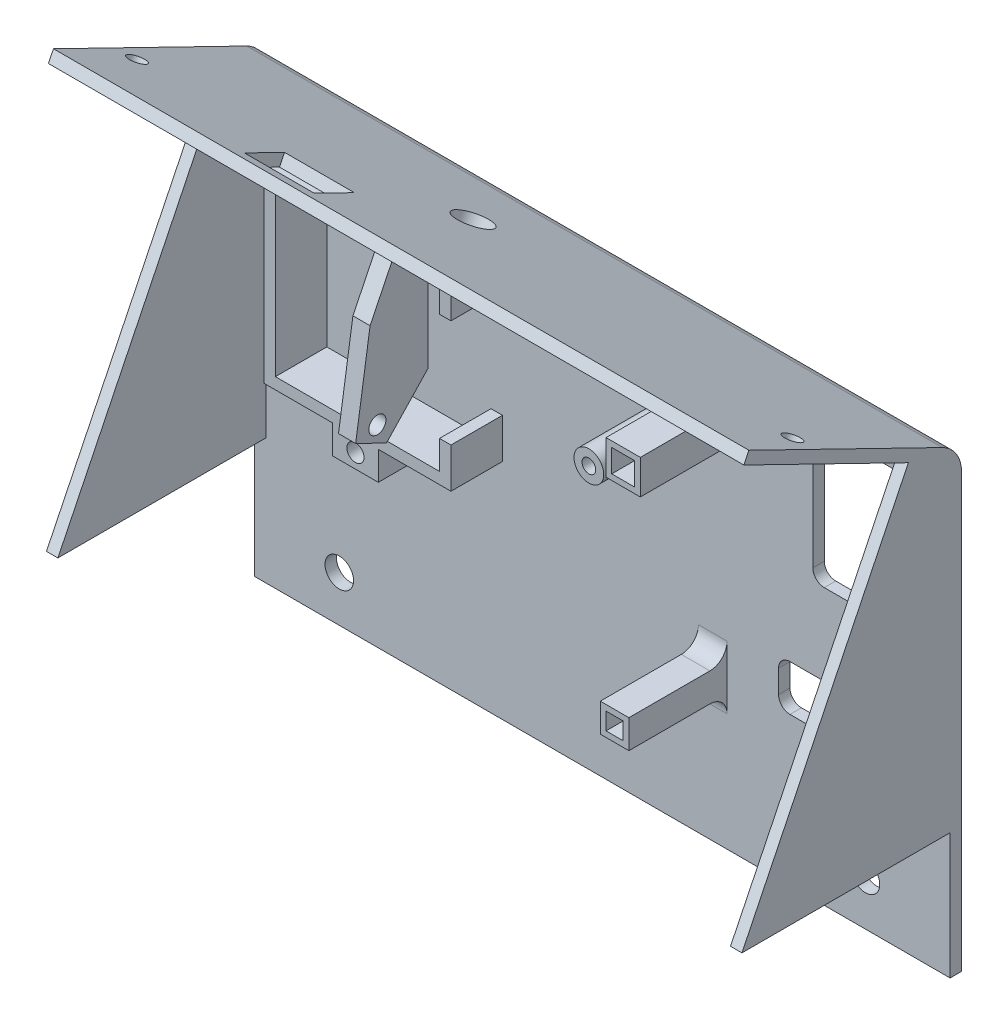
from build123d import *

# Parameters (mm, degrees)
CROQUIS1_W                 = 2
CROQUIS1_H                 = 22
SALIENTE_EXTRUIR1_DEPTH    = 121.6
VACIADO1_START             = -119.6
VACIADO1_DEPTH             = 117.6
CORTAR_EXTRUIR2_DEPTH      = 2
CROQUIS7_W                 = 10
CROQUIS7_H                 = 8
CORTAR_EXTRUIR3_DEPTH      = 10
SALIENTE_EXTRUIR4_START    = -72
CROQUIS8_W                 = 5.999999999999993
CROQUIS8_H                 = 6
CROQUIS8_W_2               = 5.000000000000007
CROQUIS8_H_2               = 5
CROQUIS8_R                 = 2.599999999999998
CROQUIS8_R_2               = 1.2000000000000022
SALIENTE_EXTRUIR4_DEPTH    = 18
REDONDEO1_R                = 3
CROQUIS10_W                = 3
CROQUIS10_H                = 16.000000000000004
SALIENTE_EXTRUIR5_DEPTH    = 30
CROQUIS10_4_R              = 3.000000000000008
CORTAR_EXTRUIR6_DEPTH      = 155.97562792830414
CROQUIS18_R                = 1.5000000000000042
CORTAR_EXTRUIR12_DEPTH     = 10
REDONDEO5_R                = 2
CORTAR_EXTRUIR13_REACH     = 172.896
CROQUIS13_R                = 1.4999999999999973
SALIENTE_EXTRUIR6_DEPTH    = 9
CORTAR_EXTRUIR18_REACH     = 146.158
REDONDEO6_R                = 2
CROQUIS14_R                = 2.499999999999995
CROQUIS14_R_2              = 2.4999999999999902
CORTAR_EXTRUIR9_DEPTH      = 10
REDONDEO4_R                = 2
CROQUIS16_R                = 1.4999999999999971
CROQUIS16_R_2              = 1.4999999999999967
CORTAR_EXTRUIR11_DEPTH     = 10
CORTAR_EXTRUIR19_REACH     = 157.881
REDONDEO7_R                = 6
CORTAR_EXTRUIR20_START     = -5
CORTAR_EXTRUIR20_OUTLINE_W = 5
CORTAR_EXTRUIR20_OUTLINE_H = 0.8399999999999963
CORTAR_EXTRUIR20_DEPTH     = 5
CORTAR_EXTRUIR21_START     = -6
CORTAR_EXTRUIR21_OUTLINE_W = 6
CORTAR_EXTRUIR21_OUTLINE_H = 0.8399999999999963
CORTAR_EXTRUIR21_DEPTH     = 6
CORTAR_EXTRUIR22_START     = -0.8400000000000002
CROQUIS25_R                = 2.599999999999998
CROQUIS25_R_2              = 1.1999999999999982
CORTAR_EXTRUIR22_DEPTH     = 0.8400000000000002


# Read off the part's stored shape, not the designer's step: Vaciado1, Cortar-Extruir20, Cortar-Extruir21
with BuildPart() as part:
    # Croquis1 → Saliente-Extruir1 (new body)
    with BuildSketch(Plane(origin=(0, 0, 0), x_dir=(0, 0, -1), z_dir=(1, 0, 0))):
        with Locations((73, 11)):
            Rectangle(CROQUIS1_W, CROQUIS1_H)
        Polygon((72, 78.1166127422233), (72, 22), (74, 22), (74, 77.14114756509154), align=None)
        Polygon((64.70784351827794, 81.67323509928094), (72, 78.11661274222328), (74, 77.14114756509154), (74, 79.36635144604195), (65.5845858118561, 83.47082319187929), align=None)
        Polygon((36.82317633028281, 97.49869988912988), (35.94643403670465, 95.70111179653155), (64.70784351827794, 81.67323509928094), (65.5845858118561, 83.47082319187929), align=None)
        Polygon((35.603262095206105, 22), (72, 22), (72, 78.1166127422233), (64.70784351827794, 81.67323509928094), align=None)
    extrude(amount=-SALIENTE_EXTRUIR1_DEPTH)

    # Vaciado1 outline → Vaciado1 (cut)
    with BuildSketch(Plane.YZ.offset(VACIADO1_START)):
        Polygon((22, -37.828465976), (22, -72), (78.116612742, -72), (80.796492806, -66.505431611), align=None)
    extrude(amount=VACIADO1_DEPTH, mode=Mode.SUBTRACT)

    # Croquis6 → Cortar-Extruir2 (cut)
    with BuildSketch(Plane(origin=(0, -9.800152925832764, -20.093291191899283), x_dir=(1, 0, 0), z_dir=(0, 0.4383711467890813, 0.8987940462991653))):
        Polygon((-119.6, 35.38091185268935), (-119.6, 99.77346901858166), (-2.0000000000000018, 99.77346901858166), (-1.999999999999988, 35.38091185268935), align=None)
    extrude(amount=-CORTAR_EXTRUIR2_DEPTH, mode=Mode.SUBTRACT)

    # Croquis7 → Cortar-Extruir3 (cut)
    with BuildSketch(Plane.XY.offset(-72)):
        Polygon((-23.999999999999996, 48.116297599242344), (-1.9999999999999971, 48.11629759924235), (-2, 72.11629759924234), (-24, 72.11629759924234), align=None)
        with Locations((-25.000000000000004, 29.91629759924235)):
            Rectangle(CROQUIS7_W, CROQUIS7_H)
        Polygon((-39.99999999999999, 27.499999999999993), (-40, 24.499999999999993), (-43, 24.499999999999993), (-43, 27.499999999999993), align=None)
        Polygon((-38.00000000000001, 67.91629759924236), (-38.00000000000001, 63.91629759924236), (-41.99999999999999, 63.91629759924236), (-42, 67.91629759924237), align=None)
    extrude(amount=-CORTAR_EXTRUIR3_DEPTH, mode=Mode.SUBTRACT)

    # Croquis8 → Saliente-Extruir4 (add)
    # profile 1 of 3: a face of its own
    with BuildSketch(Plane.XY.offset(SALIENTE_EXTRUIR4_START)):
        with Locations((-40, 65.91629759924237)):
            Rectangle(CROQUIS8_W, CROQUIS8_H)
        Polygon((-41.99999999999999, 63.91629759924236), (-42, 67.91629759924237), (-38.00000000000001, 67.91629759924236), (-38.00000000000001, 63.91629759924236), align=None, mode=Mode.SUBTRACT)
    # profile 2 of 3: a face of its own
    with BuildSketch(Plane.XY.offset(SALIENTE_EXTRUIR4_START)):
        with Locations((-41.5, 26.000000000000007)):
            Rectangle(CROQUIS8_W_2, CROQUIS8_H_2)
        Polygon((-43, 24.499999999999993), (-43, 27.499999999999993), (-39.99999999999999, 27.499999999999993), (-40, 24.499999999999993), align=None, mode=Mode.SUBTRACT)
    # profile 3 of 3: a face of its own
    with BuildSketch(Plane.XY.offset(SALIENTE_EXTRUIR4_START)):
        with Locations(Location((-46, 63.116297599242365, 0), (0, 0, 180))):
            Circle(CROQUIS8_R)
        with Locations(Location((-46, 63.116297599242365, 0), (0, 0, 180))):
            Circle(CROQUIS8_R_2, mode=Mode.SUBTRACT)
    extrude(amount=SALIENTE_EXTRUIR4_DEPTH)

    # Redondeo1
    # the kernel refuses this fillet: 3 mm, written as the material it adds along each edge
    with BuildSketch(Plane(origin=(-46, 63.116297599242365, -72), x_dir=(-1, 0, 0), z_dir=(0, 1, 0))) as redondeo1_piece_1_section:
        with BuildLine():
            CenterArc((2.5999999999999943 + REDONDEO1_R, REDONDEO1_R), REDONDEO1_R, 180, 90)
            Line((2.5999999999999943, REDONDEO1_R), (2.5999999999999943, 0))
            Line((2.5999999999999943, 0), (2.5999999999999943 + REDONDEO1_R, 0))
        make_face()
    redondeo1_piece_1 = revolve(axis=Axis((-46, 63.116297599242365, -72), (0, 0, 1)), mode=Mode.PRIVATE)
    redondeo1_piece_1 = split(redondeo1_piece_1, bisect_by=Plane(origin=(-49.240846194400426, 63.91629759924236, -71.32895989591317), z_dir=(0, -1, 0)), keep=Keep.TOP, mode=Mode.PRIVATE)
    add(redondeo1_piece_1)
    with BuildSketch(Plane(origin=(-46, 63.116297599242365, -72), x_dir=(-1, 0, 0), z_dir=(0, 1, 0))) as redondeo1_piece_2_section:
        with BuildLine():
            CenterArc((2.5999999999999943 + REDONDEO1_R, REDONDEO1_R), REDONDEO1_R, 180, 90)
            Line((2.5999999999999943, REDONDEO1_R), (2.5999999999999943, 0))
            Line((2.5999999999999943, 0), (2.5999999999999943 + REDONDEO1_R, 0))
        make_face()
    redondeo1_piece_2 = revolve(axis=Axis((-46, 63.116297599242365, -72), (0, 0, 1)), mode=Mode.PRIVATE)
    redondeo1_piece_2 = split(redondeo1_piece_2, bisect_by=Plane(origin=(-43, 66.57147018864953, -71.13888088116816), z_dir=(-1, 0, 0)), keep=Keep.TOP, mode=Mode.PRIVATE)
    add(redondeo1_piece_2)
    with BuildSketch(Plane(origin=(-37.00000000000001, 62.91629759924236, -72), x_dir=(1, 0, 0), z_dir=(0, 1, 0))) as redondeo1_piece_3:
        with BuildLine():
            CenterArc((REDONDEO1_R, -REDONDEO1_R), REDONDEO1_R, 90, 90)
            Line((0, -REDONDEO1_R), (0, 0))
            Line((0, 0), (REDONDEO1_R, 0))
        make_face()
    extrude(amount=6.000000000000007)
    with BuildSketch(Plane(origin=(-39, 28.500000000000007, -72), x_dir=(0, 1, 0), z_dir=(-1, 0, 0)), Plane(origin=(-44.00000000000001, 23.500000000000007, -72), x_dir=(0, -1, 0), z_dir=(1, 0, 0))) as redondeo1_piece_4:
        with BuildLine():
            CenterArc((REDONDEO1_R, -REDONDEO1_R), REDONDEO1_R, 90, 90)
            Line((0, -REDONDEO1_R), (0, 0))
            Line((0, 0), (REDONDEO1_R, 0))
        make_face()
    extrude(amount=5.000000000000007)

    # Croquis10 → Saliente-Extruir5 (add)
    with BuildSketch(Plane(origin=(0, 91.47338802511378, -44.6145523263787), x_dir=(1, 0, 0), z_dir=(0, -0.8987940462991649, 0.43837114678908146))):
        with Locations((-74.65448942309818, -13.855834770640188)):
            Rectangle(CROQUIS10_W, CROQUIS10_H)
    extrude(amount=SALIENTE_EXTRUIR5_DEPTH)

    # Croquis10<4> → Cortar-Extruir6 (cut, through all)
    with BuildSketch(Plane(origin=(0, 91.47338802511378, -44.6145523263787), x_dir=(1, 0, 0), z_dir=(0, -0.8987940462991649, 0.43837114678908146))):
        with Locations(Location((-69.35448942309819, -13.855834770640188, 0), (0, 0, 270))):
            Circle(CROQUIS10_4_R)
    extrude(amount=-CORTAR_EXTRUIR6_DEPTH, mode=Mode.SUBTRACT)

    # Croquis18 → Cortar-Extruir12 (cut)
    with BuildSketch(Plane.ZY.offset(76.15448942309818)):
        with Locations((-45.01288758803531, 60.68255357376121)):
            Circle(CROQUIS18_R)
        Polygon((-36.72660735066928, 61.94253763232591), (-43.74054569929451, 76.32324237311258), (-41.22057758216512, 59.75068189838051), align=None)
        Polygon((-58.1212504400812, 69.30930402448735), (-46.61334185996013, 57.12045501764605), (-51.10731209145594, 54.9285992837006), align=None)
    extrude(amount=-CORTAR_EXTRUIR12_DEPTH, mode=Mode.SUBTRACT)

    # Redondeo5
    redondeo5_edges = [part.edges().sort_by_distance(p)[0] for p in [
        (-74.65448942309818, 88.90635902130086, -49.877741754341734),
    ]]
    fillet(redondeo5_edges, radius=REDONDEO5_R)

    # Croquis19 → Cortar-Extruir13 (cut, up to next)
    with BuildSketch(Plane(origin=(0, -9.800152925832764, -20.093291191899283), x_dir=(1, 0, 0), z_dir=(0, 0.4383711467890813, 0.8987940462991653)), mode=Mode.PRIVATE) as cortar_extruir13_sk1:
        Polygon((-2.0000000000000018, 99.7734690185817), (-2.0000000000000155, 101.77346901858162), (-119.6, 101.77346901858162), (-119.6, 99.7734690185817), align=None)
    cortar_extruir13_tool1 = extrude(cortar_extruir13_sk1.sketch, amount=-CORTAR_EXTRUIR13_REACH, mode=Mode.PRIVATE) & part.part
    add(cortar_extruir13_tool1.solids().sort_by_distance((-60.8, 80.774441, -64.269472))[0], mode=Mode.SUBTRACT)

    # Croquis13 → Saliente-Extruir6 (add)
    with BuildSketch(Plane.XY.offset(-72)):
        Polygon((-80.27404089393853, 64.86915071641589), (-78.27404089393853, 64.86915071641589), (-78.27404089393853, 71.86915071641589), (-90.97404089393851, 71.86915071641587), (-90.97404089393851, 76.86915071641587), (-98.97404089393852, 76.86915071641587), (-98.97404089393854, 71.86915071641586), (-110.97404089393854, 71.86915071641587), (-110.97404089393854, 39.06915071641588), (-98.97404089393854, 39.06915071641589), (-98.97404089393852, 34.06915071641589), (-90.97404089393851, 34.06915071641589), (-90.97404089393851, 39.06915071641588), (-78.27404089393853, 39.06915071641588), (-78.27404089393853, 46.06915071641588), (-80.27404089393853, 46.06915071641588), (-80.27404089393853, 41.06915071641588), (-108.97404089393852, 41.06915071641588), (-108.97404089393852, 69.86915071641587), (-80.27404089393853, 69.86915071641589), align=None)
        with Locations((-94.97404089393854, 36.56915071641589)):
            Circle(CROQUIS13_R, mode=Mode.SUBTRACT)
        with Locations(Location((-94.97404089393854, 74.36915071641587, 0), (0, 0, 180))):
            Circle(CROQUIS13_R, mode=Mode.SUBTRACT)
    extrude(amount=SALIENTE_EXTRUIR6_DEPTH)

    # Croquis21 → Cortar-Extruir18 (cut, up to next)
    with BuildSketch(Plane.ZY.offset(76.15448942309818), mode=Mode.PRIVATE) as cortar_extruir18_sk1:
        Polygon((-53.8777532957738, 64.81471270993062), (-53.8777532957738, 86.95542303790477), (-64.25844649512833, 81.89242067267547), (-58.1212504400812, 69.30930402448735), align=None)
    cortar_extruir18_tool1 = extrude(cortar_extruir18_sk1.sketch, amount=-CORTAR_EXTRUIR18_REACH, mode=Mode.PRIVATE) & part.part
    add(cortar_extruir18_tool1.solids().sort_by_distance((-76.154489, 77.293622, -57.480803))[0], mode=Mode.SUBTRACT)

    # Redondeo6
    redondeo6_edges = [part.edges().sort_by_distance(p)[0] for p in [
        (-74.65448942309818, 86.95542303790477, -53.8777532957738),
    ]]
    fillet(redondeo6_edges, radius=REDONDEO6_R)

    # Croquis14 → Cortar-Extruir9 (cut)
    with BuildSketch(Plane(origin=(0, 0, -74), x_dir=(-1, 0, 0), z_dir=(0, 0, -1))):
        with Locations((106.80000000000001, 7.999999999999987)):
            Circle(CROQUIS14_R)
        with Locations((14.799999999999965, 7.999999999999667)):
            Circle(CROQUIS14_R_2)
    extrude(amount=-CORTAR_EXTRUIR9_DEPTH, mode=Mode.SUBTRACT)

    # Redondeo4
    redondeo4_edges = [part.edges().sort_by_distance(p)[0] for p in [
        (-20.000000000000004, 25.916297599242352, -73),
        (-30.000000000000004, 25.91629759924235, -73),
        (-30.000000000000004, 33.91629759924235, -73),
        (-24, 72.11629759924234, -73),
        (-2, 72.11629759924234, -73),
        (-1.9999999999999987, 48.11629759924235, -73),
        (-23.999999999999996, 48.116297599242344, -73),
        (-20.000000000000004, 33.91629759924235, -73),
    ]]
    fillet(redondeo4_edges, radius=REDONDEO4_R)

    # Croquis16 → Cortar-Extruir11 (cut)
    with BuildSketch(Plane(origin=(0, 93.27097611771204, -45.49129461995686), x_dir=(1, 0, 0), z_dir=(0, 0.898794046299165, -0.4383711467890815))):
        with Locations(Location((-118.1, 2.7188409262715285, 0), (0, 0, 270))):
            Circle(CROQUIS16_R)
        with Locations(Location((-3.500000000000003, 2.7188409262715423, 0), (0, 0, 90))):
            Circle(CROQUIS16_R_2)
    extrude(amount=-CORTAR_EXTRUIR11_DEPTH, mode=Mode.SUBTRACT)

    # Croquis22 → Cortar-Extruir19 (cut, up to next)
    with BuildSketch(Plane(origin=(0, 93.27097611771204, -45.49129461995686), x_dir=(1, 0, 0), z_dir=(0, 0.898794046299165, -0.4383711467890815)), mode=Mode.PRIVATE) as cortar_extruir19_sk1:
        Polygon((-77.80000000000001, 0.15583477064016854), (-90.00000000000001, 0.15583477064016854), (-90.00000000000001, -7.644165229359831), (-77.80000000000001, -7.644165229359832), align=None)
    cortar_extruir19_tool1 = extrude(cortar_extruir19_sk1.sketch, amount=-CORTAR_EXTRUIR19_REACH, mode=Mode.PRIVATE) & part.part
    add(cortar_extruir19_tool1.solids().sort_by_distance((-83.9, 94.91231, -42.126061))[0], mode=Mode.SUBTRACT)

    # Redondeo7
    redondeo7_edges = [part.edges().sort_by_distance(p)[0] for p in [
        (-60.8, 79.36635144604195, -74),
    ]]
    fillet(redondeo7_edges, radius=REDONDEO7_R)

    # Cortar-Extruir20 outline → Cortar-Extruir20 (cut)
    with BuildSketch(Plane.XZ.offset(-23.500000000000007).offset(CORTAR_EXTRUIR20_START)):
        with Locations((-41.5, -54.42)):
            Rectangle(CORTAR_EXTRUIR20_OUTLINE_W, CORTAR_EXTRUIR20_OUTLINE_H)
    extrude(amount=CORTAR_EXTRUIR20_DEPTH, mode=Mode.SUBTRACT)

    # Cortar-Extruir21 outline → Cortar-Extruir21 (cut)
    with BuildSketch(Plane.XZ.offset(-62.91629759924236).offset(CORTAR_EXTRUIR21_START)):
        with Locations((-40, -54.42)):
            Rectangle(CORTAR_EXTRUIR21_OUTLINE_W, CORTAR_EXTRUIR21_OUTLINE_H)
    extrude(amount=CORTAR_EXTRUIR21_DEPTH, mode=Mode.SUBTRACT)

    # Croquis25 → Cortar-Extruir22 (cut)
    with BuildSketch(Plane.XY.offset(-53.99999999999999).offset(CORTAR_EXTRUIR22_START)):
        with Locations(Location((-46, 63.116297599242365, 0), (0, 0, 180))):
            Circle(CROQUIS25_R)
        with Locations(Location((-46, 63.116297599242365, 0), (0, 0, 180))):
            Circle(CROQUIS25_R_2, mode=Mode.SUBTRACT)
    extrude(amount=CORTAR_EXTRUIR22_DEPTH, mode=Mode.SUBTRACT)


solid = part.part
